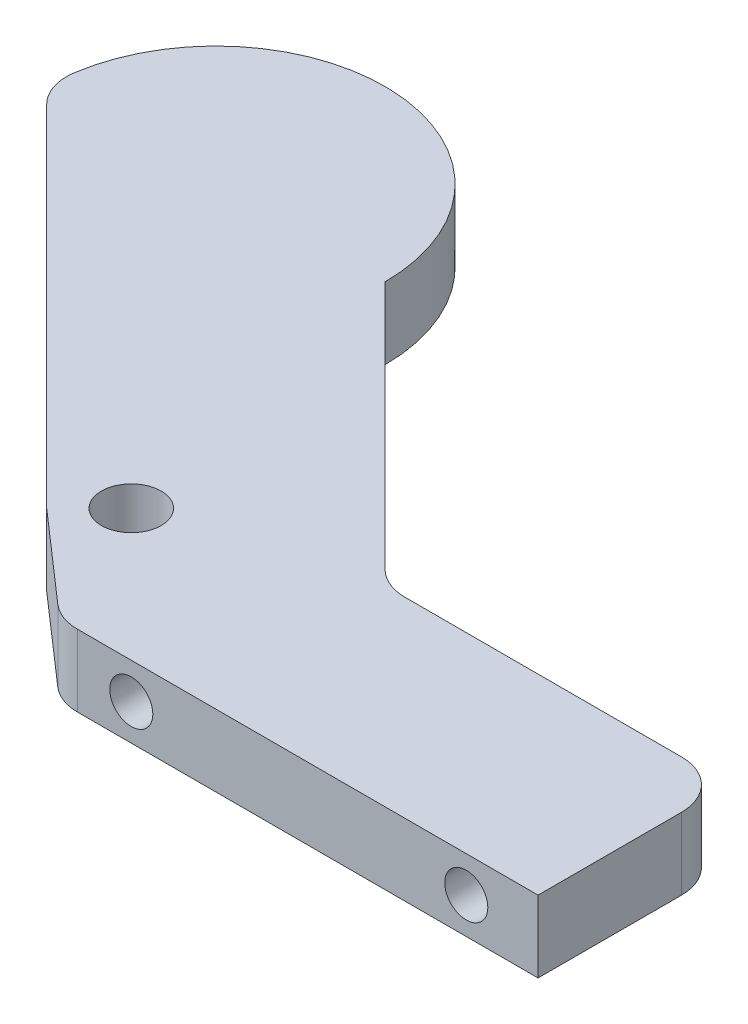
from build123d import *

# Parameters (mm, degrees)
SKETCH1_R           = 3.175
BOSS_EXTRUDE1_DEPTH = 3.81
SKETCH2_R           = 2.286
CUT_EXTRUDE1_DEPTH  = 5.08
FILLET1_R           = 5.08


with BuildPart() as part:
    # Sketch1 → Boss-Extrude1 (new, symmetric)
    with BuildSketch(Plane(origin=(0, 0, 0), x_dir=(1, 0, 0), z_dir=(0, 1, 0))):
        with BuildLine():
            Line((-43.270256121, 34.29), (-4.490128061, -4.490128061))
            Line((-4.490128061, -4.490128061), (6.35, -13.97))
            Line((6.35, -13.97), (57.15, -13.97))
            Line((57.15, -13.97), (57.15, 6.35))
            Line((57.15, 6.35), (20.590768363, 6.35))
            Line((20.590768363, 6.35), (-7.349231637, 34.29))
            ThreePointArc((-7.349231637, 34.29), (-25.309743879, 52.250512242), (-43.270256121, 34.29))
        make_face()
        Circle(SKETCH1_R, mode=Mode.SUBTRACT)
    extrude(amount=BOSS_EXTRUDE1_DEPTH, both=True)

    # Sketch2 → Cut-Extrude1 (cut)
    with BuildSketch(Plane.XY.offset(13.97)):
        with Locations((13.97, 0)):
            Circle(SKETCH2_R)
        with Locations((49.53, 0)):
            Circle(SKETCH2_R)
    extrude(amount=-CUT_EXTRUDE1_DEPTH, mode=Mode.SUBTRACT)

    # Fillet1
    fillet1_edges = [part.edges().sort_by_distance(p)[0] for p in [
        (57.15, 0, -6.35),
        (20.590768363, 0, -6.35),
        (6.35, 0, 13.97),
        (-43.270256121, 0, -34.29),
    ]]
    fillet(fillet1_edges, radius=FILLET1_R)


solid = part.part
